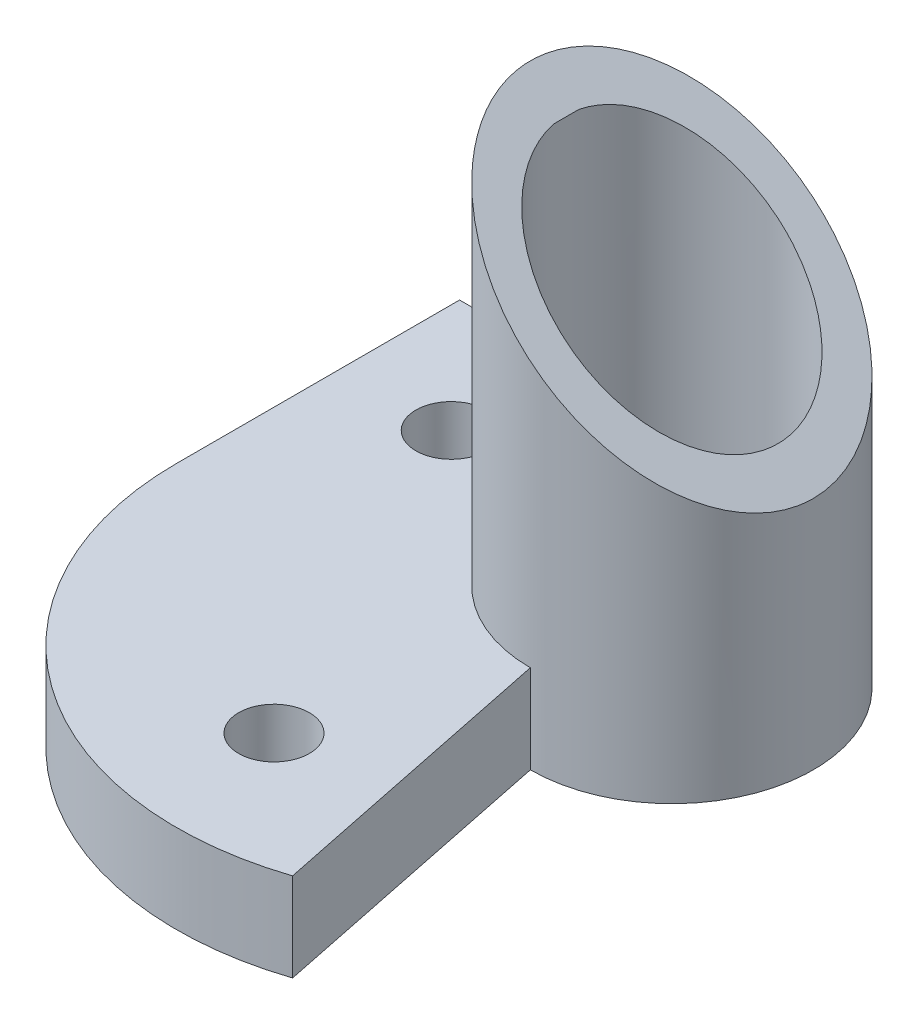
from build123d import *

# Parameters (mm, degrees)
BOSS_EXTRUDE1_DEPTH      = 30
BOSS_EXTRUDE1_DEPTH_BACK = 20
SKETCH1_R                = 8
SKETCH1_4_R              = 6
SKETCH2_R                = 6
SKETCH1_5_R              = 6
CUT_EXTRUDE1_DEPTH       = 5
BOSS_EXTRUDE3_START      = -5
BOSS_EXTRUDE3_OUTLINE_R  = 2
BOSS_EXTRUDE3_DEPTH      = 5


# Read off the part's stored shape, not the designer's step: Boss-Extrude3
with BuildPart() as part:
    # Sketch1 → Boss-Extrude1 (new, two sides: drawn at the far end of the back side and taken through both)
    with BuildSketch(Plane(origin=(0, 0, 0), x_dir=(1, 0, 0), z_dir=(0, 1, 0)).offset(-BOSS_EXTRUDE1_DEPTH_BACK)):
        with Locations(Location((0, 0, 0), (0, 0, 270))):
            Circle(SKETCH1_R)
    extrude(amount=BOSS_EXTRUDE1_DEPTH + BOSS_EXTRUDE1_DEPTH_BACK)

    # SurfaceCut1
    split(bisect_by=Plane(origin=(0, 0, 0), x_dir=(0, 0, -1), z_dir=(0.6427876096865405, 0.766044443118977, -2.2049215546234306e-15)), keep=Keep.BOTTOM)

    # Sketch1<4> → Cut-Loft1 section 0
    with BuildSketch(Plane(origin=(0, 0, 0), x_dir=(1, 0, 0), z_dir=(0, 1, 0))):
        Circle(SKETCH1_4_R)
    # Sketch2 → Cut-Loft1 section 1
    with BuildSketch(Plane.XZ.offset(20)):
        Circle(SKETCH2_R)
    loft(mode=Mode.SUBTRACT)

    # Sketch1<5> → Cut-Extrude1 (cut)
    with BuildSketch(Plane(origin=(0, 0, 0), x_dir=(1, 0, 0), z_dir=(0, 1, 0))):
        with Locations(Location((0, 0, 0), (0, 0, 90))):
            Circle(SKETCH1_5_R)
    extrude(amount=CUT_EXTRUDE1_DEPTH, mode=Mode.SUBTRACT)

    # Boss-Extrude3 outline → Boss-Extrude3 (add)
    with BuildSketch(Plane.XZ.offset(20).offset(BOSS_EXTRUDE3_START)):
        with BuildLine():
            Line((-20, -8), (0, -8))
            ThreePointArc((0, -8), (-8, 0), (0, 8))
            Line((0, 8), (3.468102534, 24.907883087))
            ThreePointArc((3.468102534, 24.907883087), (-12.594718707, 22.462264233), (-20, 8))
            Line((-20, 8), (-20, -8))
        make_face()
        with Locations((-13.851036571, -1.379219301)):
            Circle(BOSS_EXTRUDE3_OUTLINE_R, mode=Mode.SUBTRACT)
        with Locations((-4.045326452, 18.443425538)):
            Circle(BOSS_EXTRUDE3_OUTLINE_R, mode=Mode.SUBTRACT)
    extrude(amount=BOSS_EXTRUDE3_DEPTH)


solid = part.part
